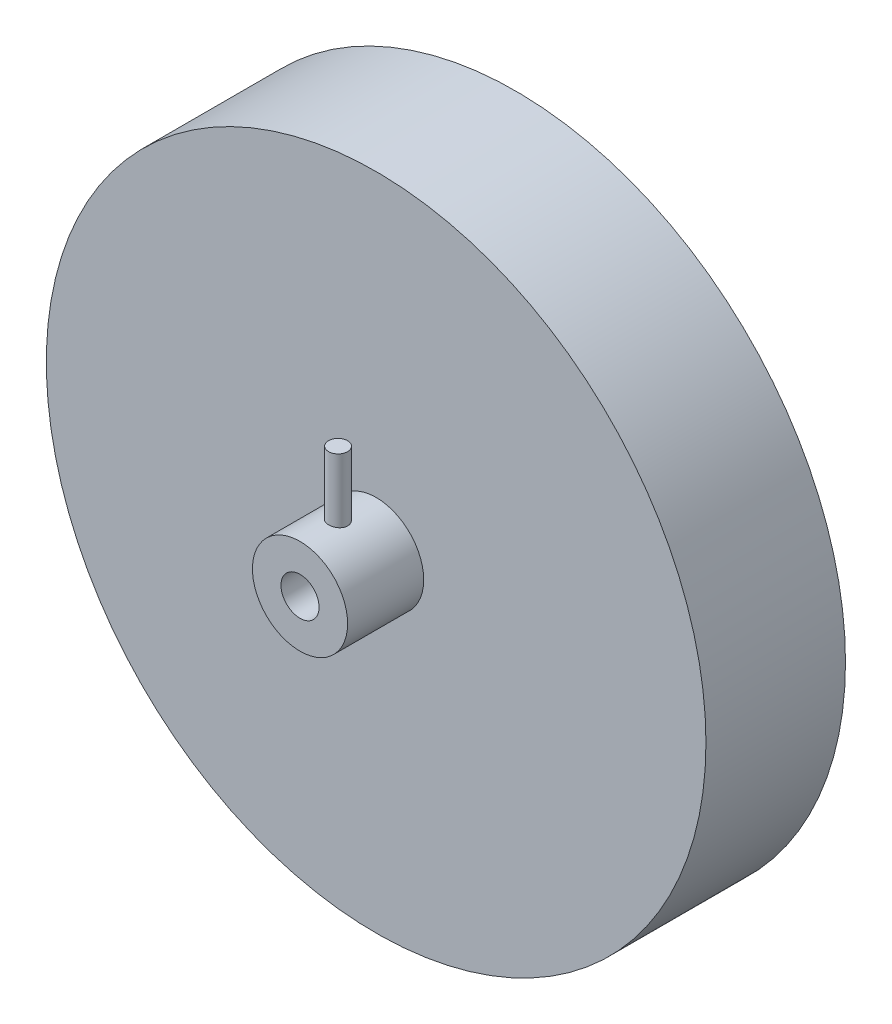
from build123d import *

# Parameters (mm, degrees)
SKETCH1_R           = 52
BOSS_EXTRUDE1_DEPTH = 11
SKETCH2_R           = 7.5
BOSS_EXTRUDE2_DEPTH = 12
SKETCH3_R           = 1.5
BOSS_EXTRUDE3_DEPTH = 17.5
SKETCH4_R           = 3
CUT_EXTRUDE3_DEPTH  = 12


with BuildPart() as part:
    # Sketch1 → Boss-Extrude1 (new, symmetric)
    with BuildSketch(Plane.XY):
        Circle(SKETCH1_R)
    extrude(amount=BOSS_EXTRUDE1_DEPTH, both=True)

    # Sketch2 → Boss-Extrude2 (add)
    with BuildSketch(Plane.XY.offset(11)):
        Circle(SKETCH2_R)
    extrude(amount=BOSS_EXTRUDE2_DEPTH)

    # Sketch3 → Boss-Extrude3 (add)
    with BuildSketch(Plane(origin=(0, 0, 0), x_dir=(1, 0, 0), z_dir=(0, 1, 0))):
        with Locations((0, -17)):
            Circle(SKETCH3_R)
    extrude(amount=BOSS_EXTRUDE3_DEPTH)

    # Sketch4 → Cut-Extrude3 (cut)
    with BuildSketch(Plane(origin=(0, 0, 23), x_dir=(-1, 0, 0), z_dir=(0, 0, -1))):
        Circle(SKETCH4_R)
    extrude(amount=CUT_EXTRUDE3_DEPTH, mode=Mode.SUBTRACT)


solid = part.part
